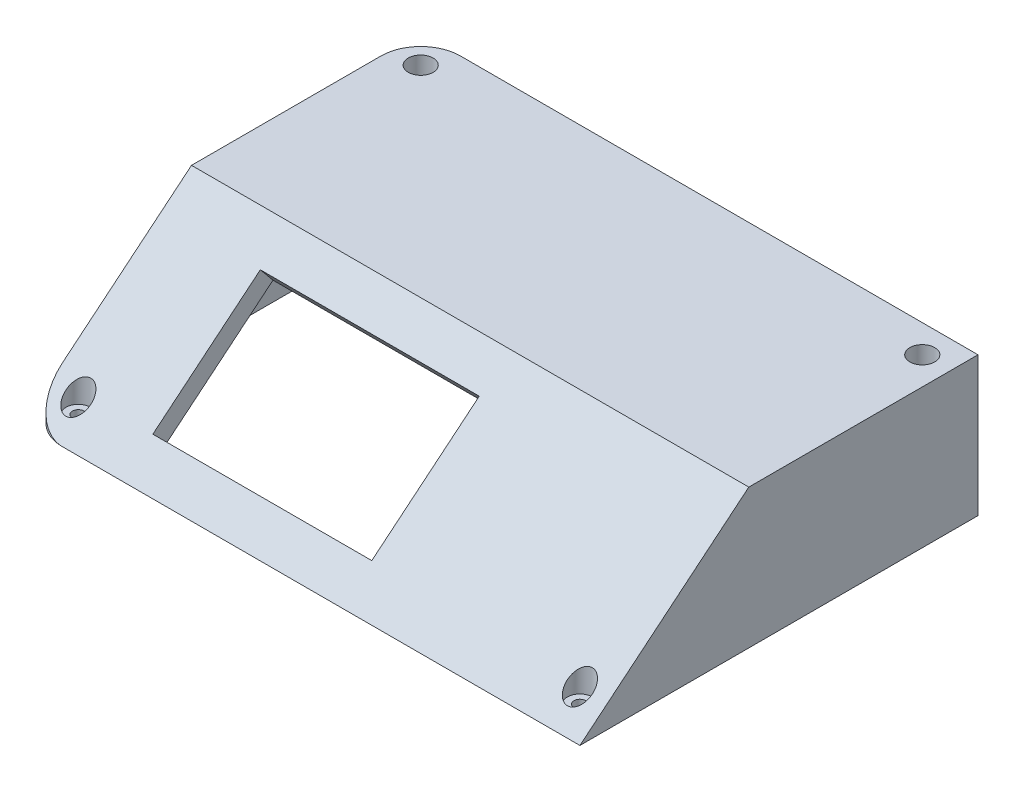
from build123d import *

# Parameters (mm, degrees)
SKETCH2_W               = 57.573593128
SKETCH2_H               = 35
BOSS_EXTRUDE1_DEPTH     = 140
CUT_EXTRUDE1_DEPTH      = 65
CUT_EXTRUDE1_DEPTH_BACK = 65
SKETCH4_W               = 55
SKETCH4_H               = 35
CUT_EXTRUDE2_DEPTH      = 5
CUT_EXTRUDE3_DEPTH      = 161.923336852
BOSS_EXTRUDE2_START     = -135
BOSS_EXTRUDE2_DEPTH     = 10
BOSS_EXTRUDE2_START_2   = -15
BOSS_EXTRUDE2_2_DEPTH   = 10
SKETCH8_3_W             = 10
SKETCH8_3_H             = 10
BOSS_EXTRUDE3_DEPTH     = 30
SKETCH7_R               = 3.125
SKETCH7_R_2             = 1.5
CUT_EXTRUDE5_DEPTH      = 33
SKETCH7_4_R             = 1.5
CUT_EXTRUDE6_DEPTH      = 35


# Read off the part's stored shape, not the designer's step: Boss-Extrude2
with BuildPart() as part:
    # Sketch2 → Boss-Extrude1 (new body)
    with BuildSketch(Plane(origin=(0, 0, 0), x_dir=(0, 0, -1), z_dir=(1, 0, 0))):
        Polygon((-28.786796564, 17.5), (-71.213203436, -17.5), (-28.786796564, -17.5), align=None)
        Rectangle(SKETCH2_W, SKETCH2_H)
        Polygon((-26.990568975, 12.5), (-28.786796564, 11.018187839), (-28.786796564, -17.5), (23.786796564, -17.5), (23.786796564, 12.5), align=None)
        Polygon((-28.786796564, -17.5), (-28.786796564, 11.018187839), (-63.356060578, -17.5), align=None)
    extrude(amount=-BOSS_EXTRUDE1_DEPTH)

    # Sketch3 → Cut-Extrude1 (cut, two sides: drawn at the far end of the back side and taken through both)
    with BuildSketch(Plane.ZY.offset(70).offset(-CUT_EXTRUDE1_DEPTH_BACK)):
        Polygon((-23.786796564, -17.5), (-23.786796564, 12.5), (26.990568975, 12.5), (63.356060578, -17.5), align=None)
    extrude(amount=CUT_EXTRUDE1_DEPTH + CUT_EXTRUDE1_DEPTH_BACK, mode=Mode.SUBTRACT)

    # Sketch4 → Cut-Extrude2 (cut)
    with BuildSketch(Plane(origin=(0, 24.544202322, 20.247933884), x_dir=(1, 0, 0), z_dir=(0, 0.77138921583987, 0.6363636363636365))):
        with Locations((-87.5, -38.569460792)):
            Rectangle(SKETCH4_W, SKETCH4_H)
    extrude(amount=-CUT_EXTRUDE2_DEPTH, mode=Mode.SUBTRACT)

    # Sketch6 → Cut-Extrude3 (cut, through all)
    with BuildSketch(Plane.XZ.offset(17.5)):
        with BuildLine():
            Line((-140, 61.213203436), (-140, 71.213203436))
            Line((-140, 71.213203436), (-130, 71.213203436))
            ThreePointArc((-130, 71.213203436), (-137.071067812, 68.284271247), (-140, 61.213203436))
        make_face()
        with BuildLine():
            Line((-140, -18.786796564), (-140, -28.786796564))
            Line((-140, -28.786796564), (-130, -28.786796564))
            ThreePointArc((-130, -28.786796564), (-137.071067812, -25.857864376), (-140, -18.786796564))
        make_face()
    extrude(amount=-CUT_EXTRUDE3_DEPTH, mode=Mode.SUBTRACT)

    # Boss-Extrude2 outline → Boss-Extrude2 (add)
    with BuildSketch(Plane.YZ.offset(BOSS_EXTRUDE2_START)):
        Polygon((-9.250420886, 53.356060578), (-17.5, 63.356060578), (-17.5, 53.356060578), align=None)
    extrude(amount=BOSS_EXTRUDE2_DEPTH)

    # Boss-Extrude2 2 outline → Boss-Extrude2 2 (add)
    with BuildSketch(Plane.YZ.offset(BOSS_EXTRUDE2_START_2)):
        Polygon((-9.250420886, 53.356060578), (-17.5, 63.356060578), (-17.5, 53.356060578), align=None)
    extrude(amount=BOSS_EXTRUDE2_2_DEPTH)

    # Sketch8<3> → Boss-Extrude3 (add)
    with BuildSketch(Plane.XZ.offset(17.5)):
        with Locations((-130, -18.786796564)):
            Rectangle(SKETCH8_3_W, SKETCH8_3_H)
        with Locations((-10, -18.786796564)):
            Rectangle(SKETCH8_3_W, SKETCH8_3_H)
    extrude(amount=-BOSS_EXTRUDE3_DEPTH)

    # Sketch7 → Cut-Extrude5 (cut)
    # profile 1 of 4: a face of its own
    with BuildSketch(Plane(origin=(0, 17.5, 0), x_dir=(1, 0, 0), z_dir=(0, 1, 0))):
        with Locations(Location((-133, 21.786796564, 0), (0, 0, 270))):
            Circle(SKETCH7_R)
        with Locations(Location((-133, 21.786796564, 0), (0, 0, 270))):
            Circle(SKETCH7_R_2, mode=Mode.SUBTRACT)
    # profile 2 of 4: a face of its own
    with BuildSketch(Plane(origin=(0, 17.5, 0), x_dir=(1, 0, 0), z_dir=(0, 1, 0))):
        with Locations(Location((-7, 21.786796564, 0), (0, 0, 270))):
            Circle(SKETCH7_R)
        with Locations(Location((-7, 21.786796564, 0), (0, 0, 270))):
            Circle(SKETCH7_R_2, mode=Mode.SUBTRACT)
    # profile 3 of 4: a face of its own
    with BuildSketch(Plane(origin=(0, 17.5, 0), x_dir=(1, 0, 0), z_dir=(0, 1, 0))):
        with Locations(Location((-7, -64.213203436, 0), (0, 0, 90))):
            Circle(SKETCH7_R)
        with Locations(Location((-7, -64.213203436, 0), (0, 0, 90))):
            Circle(SKETCH7_R_2, mode=Mode.SUBTRACT)
    # profile 4 of 4: a face of its own
    with BuildSketch(Plane(origin=(0, 17.5, 0), x_dir=(1, 0, 0), z_dir=(0, 1, 0))):
        with Locations(Location((-133, -64.213203436, 0), (0, 0, 90))):
            Circle(SKETCH7_R)
        with Locations(Location((-133, -64.213203436, 0), (0, 0, 90))):
            Circle(SKETCH7_R_2, mode=Mode.SUBTRACT)
    extrude(amount=-CUT_EXTRUDE5_DEPTH, mode=Mode.SUBTRACT)

    # Sketch7<4> → Cut-Extrude6 (cut)
    with BuildSketch(Plane(origin=(0, 17.5, 0), x_dir=(1, 0, 0), z_dir=(0, 1, 0))):
        with Locations(Location((-133, -64.213203436, 0), (0, 0, 90))):
            Circle(SKETCH7_4_R)
        with Locations(Location((-133, 21.786796564, 0), (0, 0, 90))):
            Circle(SKETCH7_4_R)
        with Locations(Location((-7, 21.786796564, 0), (0, 0, 90))):
            Circle(SKETCH7_4_R)
        with Locations(Location((-7, -64.213203436, 0), (0, 0, 90))):
            Circle(SKETCH7_4_R)
    extrude(amount=-CUT_EXTRUDE6_DEPTH, mode=Mode.SUBTRACT)


solid = part.part
